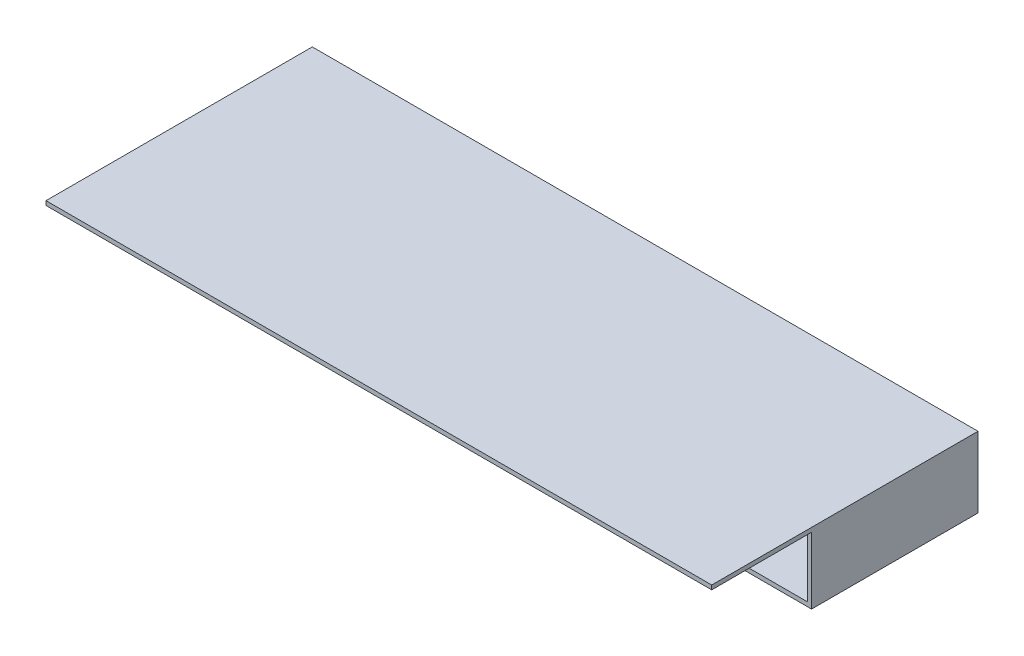
from build123d import *

# Parameters (mm, degrees)
SKETCH1_W           = 2000
SKETCH1_H           = 800
BOSS_EXTRUDE1_DEPTH = 12.7
SKETCH2_W           = 2000
SKETCH2_H           = 500
BOSS_EXTRUDE2_DEPTH = 200
SHELL1_START        = -187.3
SHELL1_OUTLINE_W    = 1974.6
SHELL1_OUTLINE_H    = 487.3
SHELL1_DEPTH        = 187.3
SKETCH4_W           = 25.4
SKETCH4_H           = 187.3
BOSS_EXTRUDE3_DEPTH = 487.3


# Read off the part's stored shape, not the designer's step: Shell1
with BuildPart() as part:
    # Sketch1 → Boss-Extrude1 (new body)
    with BuildSketch(Plane(origin=(0, 0, 0), x_dir=(1, 0, 0), z_dir=(0, 1, 0))):
        Rectangle(SKETCH1_W, SKETCH1_H)
    extrude(amount=BOSS_EXTRUDE1_DEPTH)

    # Sketch2 → Boss-Extrude2 (add)
    with BuildSketch(Plane.XZ):
        with Locations((0, -150)):
            Rectangle(SKETCH2_W, SKETCH2_H)
    extrude(amount=BOSS_EXTRUDE2_DEPTH)

    # Shell1 outline → Shell1 (cut)
    with BuildSketch(Plane(origin=(0, 0, 0), x_dir=(1, 0, 0), z_dir=(0, 1, 0)).offset(SHELL1_START)):
        with Locations((0, 143.65)):
            Rectangle(SHELL1_OUTLINE_W, SHELL1_OUTLINE_H)
    extrude(amount=SHELL1_DEPTH, mode=Mode.SUBTRACT)

    # Sketch4 → Boss-Extrude3 (add)
    with BuildSketch(Plane.XY.offset(-387.3)):
        with Locations((0, -93.65)):
            Rectangle(SKETCH4_W, SKETCH4_H)
    extrude(amount=BOSS_EXTRUDE3_DEPTH)


solid = part.part
